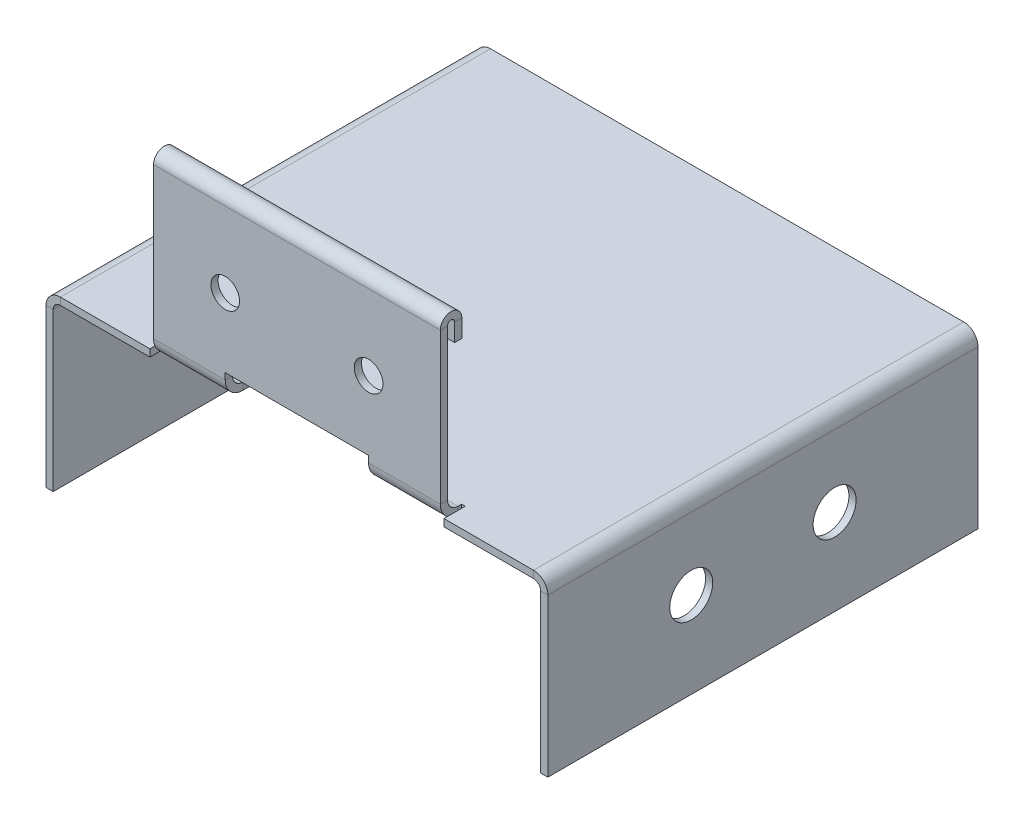
from build123d import *

# Parameters (mm, degrees)
SKETCH1_W                     = 35
SKETCH1_H                     = 30
BASE_FLANGE1_DEPTH            = 0.5
EDGE_FLANGE1_STRIP_W          = 3
EDGE_FLANGE1_STRIP_H          = 0.5
EDGE_FLANGE1_STRIP_CUT_DEPTH  = 30
EDGE_FLANGE1_DEPTH            = 30
EDGE_FLANGE2_STRIP_W          = 3
EDGE_FLANGE2_STRIP_H          = 0.5
EDGE_FLANGE2_STRIP_CUT_DEPTH  = 30
EDGE_FLANGE2_DEPTH            = 30
SKETCH12_R                    = 1.5
CUT_EXTRUDE1_DEPTH            = 40
EDGE_FLANGE4_STRIP_W          = 3.4732
EDGE_FLANGE4_STRIP_H          = 0.5
EDGE_FLANGE4_STRIP_CUT_DEPTH  = 20
EDGE_FLANGE4_RELIEF_W         = 3.7232
EDGE_FLANGE4_RELIEF_H         = 0.25
EDGE_FLANGE4_RELIEF_CUT_DEPTH = 0.5
EDGE_FLANGE4_DEPTH            = 20
SKETCH25_R                    = 1
CUT_EXTRUDE2_DEPTH            = 0.5
HEM1_START                    = 7.5
HEM1_DEPTH                    = 20
HEM1_2_DEPTH                  = 20
UNFOLD1_OUTLINE_W             = 20
UNFOLD1_OUTLINE_H             = 1.5
UNFOLD1_DEPTH                 = 13
UNFOLD1_START                 = -0.5
UNFOLD1_2_OUTLINE_W           = 20
UNFOLD1_2_OUTLINE_H           = 11.076547656
UNFOLD1_2_OUTLINE_R           = 1
UNFOLD1_2_DEPTH               = 0.5
UNFOLD1_START_2               = 7.5
UNFOLD1_3_DEPTH               = 20
SKETCH30_W                    = 10
SKETCH30_H                    = 4
CUT_EXTRUDE3_DEPTH            = 0.5
FOLD1_START                   = 7.5
FOLD1_DEPTH                   = 20
FOLD1_START_2                 = 13.5000001
FOLD1_2_DEPTH                 = 7.9999998
FOLD1_3_DEPTH                 = 3.9999999
FOLD1_START_3                 = 23.5000001
FOLD1_4_DEPTH                 = 3.9999999
FOLD1_5_DEPTH                 = 5
FOLD1_START_4                 = 22.5
FOLD1_6_DEPTH                 = 5
FOLD1_START_5                 = -0.5
FOLD1_7_DEPTH                 = 0.5
FOLD1_START_6                 = 11.4999999
FOLD1_8_DEPTH                 = 12.0000002


with BuildPart() as part:
    # Base-Flange1: sheet metal written as solids
    # Sketch1 → Base-Flange1 (new body)
    with BuildSketch(Plane(origin=(0, 0, 0), x_dir=(1, 0, 0), z_dir=(0, 1, 0))):
        with Locations((17.5, 15)):
            Rectangle(SKETCH1_W, SKETCH1_H)
    extrude(amount=-BASE_FLANGE1_DEPTH)

    # Edge-Flange1: sheet metal written as solids
    # Edge-Flange1 strip (on a plane across the edge) → Edge-Flange1 strip cut (cut)
    with BuildSketch(Plane(origin=(35, -0.5, -30), x_dir=(-1, 0, 0), z_dir=(0, 0, 1))):
        with Locations((-0.5, -0.25)):
            Rectangle(EDGE_FLANGE1_STRIP_W, EDGE_FLANGE1_STRIP_H)
    extrude(amount=EDGE_FLANGE1_STRIP_CUT_DEPTH, mode=Mode.SUBTRACT)

    # Edge-Flange1 section (on a plane across the edge) → Edge-Flange1 (add)
    with BuildSketch(Plane(origin=(35, -0.5, -30), x_dir=(-1, 0, 0), z_dir=(0, 0, 1))):
        with BuildLine():
            Line((0, 0.5), (0, 11.5))
            Line((0, 11.5), (0.5, 11.5))
            Line((0.5, 11.5), (0.5, 0.5))
            ThreePointArc((0.5, 0.5), (0.646446609, 0.146446609), (1, 0))
            Line((1, 0), (1, -0.5))
            ThreePointArc((1, -0.5), (0.292893219, -0.207106781), (0, 0.5))
        make_face()
    extrude(amount=EDGE_FLANGE1_DEPTH)

    # Edge-Flange2: sheet metal written as solids
    # Edge-Flange2 strip (on a plane across the edge) → Edge-Flange2 strip cut (cut)
    with BuildSketch(Plane(origin=(0, -0.5, 0), x_dir=(1, 0, 0), z_dir=(0, 0, -1))):
        with Locations((-0.5, -0.25)):
            Rectangle(EDGE_FLANGE2_STRIP_W, EDGE_FLANGE2_STRIP_H)
    extrude(amount=EDGE_FLANGE2_STRIP_CUT_DEPTH, mode=Mode.SUBTRACT)

    # Edge-Flange2 section (on a plane across the edge) → Edge-Flange2 (add)
    with BuildSketch(Plane(origin=(0, -0.5, 0), x_dir=(1, 0, 0), z_dir=(0, 0, -1))):
        with BuildLine():
            Line((0, 0.5), (0, 11.5))
            Line((0, 11.5), (0.5, 11.5))
            Line((0.5, 11.5), (0.5, 0.5))
            ThreePointArc((0.5, 0.5), (0.646446609, 0.146446609), (1, 0))
            Line((1, 0), (1, -0.5))
            ThreePointArc((1, -0.5), (0.292893219, -0.207106781), (0, 0.5))
        make_face()
    extrude(amount=EDGE_FLANGE2_DEPTH)

    # Sketch12 → Cut-Extrude1 (cut)
    with BuildSketch(Plane.ZY):
        with Locations(Location((-20, -6, 0), (0, 0, 270))):
            Circle(SKETCH12_R)
        with Locations(Location((-10, -6, 0), (0, 0, 270))):
            Circle(SKETCH12_R)
    extrude(amount=-CUT_EXTRUDE1_DEPTH, mode=Mode.SUBTRACT)

    # Edge-Flange4: sheet metal written as solids
    # Edge-Flange4 strip (on a plane across the edge) → Edge-Flange4 strip cut (cut)
    with BuildSketch(Plane(origin=(7.5, 0, 0), x_dir=(0, 0, -1), z_dir=(1, 0, 0))):
        with Locations((-0.5, -0.25)):
            Rectangle(EDGE_FLANGE4_STRIP_W, EDGE_FLANGE4_STRIP_H)
    extrude(amount=EDGE_FLANGE4_STRIP_CUT_DEPTH, mode=Mode.SUBTRACT)

    # Edge-Flange4 relief (on the sheet) → Edge-Flange4 relief cut (cut)
    with BuildSketch(Plane(origin=(7.5, 0, -1.2366), x_dir=(0, 0, -1), z_dir=(0, 1, 0))):
        with Locations((-1.6116, 0.125)):
            Rectangle(EDGE_FLANGE4_RELIEF_W, EDGE_FLANGE4_RELIEF_H)
        with Locations((-1.6116, -20.125)):
            Rectangle(EDGE_FLANGE4_RELIEF_W, EDGE_FLANGE4_RELIEF_H)
    extrude(amount=-EDGE_FLANGE4_RELIEF_CUT_DEPTH, mode=Mode.SUBTRACT)

    # Edge-Flange4 section (on a plane across the edge) → Edge-Flange4 (add)
    with BuildSketch(Plane(origin=(7.5, 0, 0), x_dir=(0, 0, -1), z_dir=(1, 0, 0))):
        with BuildLine():
            Line((0, 0.7366), (0, 12))
            Line((0, 12), (0.5, 12))
            Line((0.5, 12), (0.5, 0.7366))
            ThreePointArc((0.5, 0.7366), (0.715745145, 0.215745145), (1.2366, 0))
            Line((1.2366, 0), (1.2366, -0.5))
            ThreePointArc((1.2366, -0.5), (0.362191754, -0.137808246), (0, 0.7366))
        make_face()
    extrude(amount=EDGE_FLANGE4_DEPTH)

    # Sketch25 → Cut-Extrude2 (cut)
    with BuildSketch(Plane.XY):
        with Locations((12.5, 6)):
            Circle(SKETCH25_R)
        with Locations(Location((22.5, 6, 0), (0, 0, 180))):
            Circle(SKETCH25_R)
    extrude(amount=-CUT_EXTRUDE2_DEPTH, mode=Mode.SUBTRACT)

    # Hem1: read off the stored shape, not the designer's step
    # Hem1 outline → Hem1 (cut)
    with BuildSketch(Plane.YZ.offset(HEM1_START)):
        with BuildLine():
            ThreePointArc((11.25, 0), (11.683012702, -0.137627564), (11.957106781, -0.5))
            Line((11.957106781, -0.5), (12, -0.5))
            Line((12, -0.5), (12, 0))
            Line((12, 0), (11.25, 0))
        make_face()
    extrude(amount=HEM1_DEPTH, mode=Mode.SUBTRACT)

    # Hem1 2 outline → Hem1 2 (add)
    with BuildSketch(Plane.YZ.offset(HEM1_START)):
        with BuildLine():
            Line((10, -1), (10, -1.5))
            Line((10, -1.5), (11.25, -1.5))
            ThreePointArc((11.25, -1.5), (11.862372436, -1.183012702), (11.957106781, -0.5))
            Line((11.957106781, -0.5), (11.25, -0.5))
            ThreePointArc((11.25, -0.5), (11.5, -0.75), (11.25, -1))
            Line((11.25, -1), (10, -1))
        make_face()
    extrude(amount=HEM1_2_DEPTH)

    # Unfold1: read off the stored shape, not the designer's step
    # Unfold1 outline → Unfold1 (cut)
    with BuildSketch(Plane(origin=(0, 0, 0), x_dir=(1, 0, 0), z_dir=(0, 1, 0))):
        with Locations((17.5, 0.75)):
            Rectangle(UNFOLD1_OUTLINE_W, UNFOLD1_OUTLINE_H)
    extrude(amount=UNFOLD1_DEPTH, mode=Mode.SUBTRACT)

    # Unfold1 2 outline → Unfold1 2 (add)
    with BuildSketch(Plane(origin=(0, 0, 0), x_dir=(1, 0, 0), z_dir=(0, 1, 0)).offset(UNFOLD1_START)):
        with Locations((17.5, -4.038273828)):
            Rectangle(UNFOLD1_2_OUTLINE_W, UNFOLD1_2_OUTLINE_H)
        with Locations((12.5, -5.576547656)):
            Circle(UNFOLD1_2_OUTLINE_R, mode=Mode.SUBTRACT)
        with Locations((22.5, -5.576547656)):
            Circle(UNFOLD1_2_OUTLINE_R, mode=Mode.SUBTRACT)
    extrude(amount=UNFOLD1_2_DEPTH)

    # Unfold1 3 outline → Unfold1 3 (add)
    with BuildSketch(Plane.YZ.offset(UNFOLD1_START_2)):
        with BuildLine():
            Line((-0.5, 10.826547656), (-0.5, 9.576547656))
            Line((-0.5, 9.576547656), (0, 9.576547656))
            Line((0, 9.576547656), (0, 10.826547656))
            ThreePointArc((0, 10.826547656), (0.25, 11.076547656), (0.5, 10.826547656))
            Line((0.5, 10.826547656), (0.5, 9.576547656))
            Line((0.5, 9.576547656), (1, 9.576547656))
            Line((1, 9.576547656), (1, 10.826547656))
            ThreePointArc((1, 10.826547656), (0.25, 11.576547656), (-0.5, 10.826547656))
        make_face()
    extrude(amount=UNFOLD1_3_DEPTH)

    # Sketch30 → Cut-Extrude3 (cut)
    with BuildSketch(Plane(origin=(0, 0, 0), x_dir=(1, 0, 0), z_dir=(0, 1, 0))):
        with Locations((17.5, 1.2366)):
            Rectangle(SKETCH30_W, SKETCH30_H)
    extrude(amount=-CUT_EXTRUDE3_DEPTH, mode=Mode.SUBTRACT)

    # Fold1: read off the stored shape, not the designer's step
    # Fold1 outline → Fold1 (cut)
    with BuildSketch(Plane.YZ.offset(FOLD1_START)):
        with BuildLine():
            ThreePointArc((-0.5, -1.2366), (-0.367949483, -0.68058741), (0, -0.243322596))
            Line((0, -0.243322596), (0, 10.826547656))
            ThreePointArc((0, 10.826547656), (0.25, 11.076547656), (0.5, 10.826547656))
            Line((0.5, 10.826547656), (0.5, 9.576547656))
            Line((0.5, 9.576547656), (1, 9.576547656))
            Line((1, 9.576547656), (1, 10.826547656))
            ThreePointArc((1, 10.826547656), (0.25, 11.576547656), (-0.5, 10.826547656))
            Line((-0.5, 10.826547656), (-0.5, -1.2366))
        make_face()
    extrude(amount=FOLD1_DEPTH, mode=Mode.SUBTRACT)

    # Fold1 3 outline → Fold1 3 (add)
    with BuildSketch(Plane.YZ.offset(FOLD1_START)):
        with BuildLine():
            ThreePointArc((0.7366, 0), (0.348725843, -0.062405298), (0, -0.243322596))
            Line((0, -0.243322596), (0, -1.2366))
            ThreePointArc((0, -1.2366), (0.215745145, -0.715745145), (0.7366, -0.5))
            Line((0.7366, -0.5), (11.25, -0.5))
            ThreePointArc((11.25, -0.5), (11.5, -0.75), (11.25, -1))
            Line((11.25, -1), (10, -1))
            Line((10, -1), (10, -1.5))
            Line((10, -1.5), (11.25, -1.5))
            ThreePointArc((11.25, -1.5), (12, -0.75), (11.25, 0))
            Line((11.25, 0), (0.7366, 0))
        make_face()
    extrude(amount=FOLD1_3_DEPTH)

    # Fold1 4 outline → Fold1 4 (add)
    with BuildSketch(Plane.YZ.offset(FOLD1_START_3)):
        with BuildLine():
            ThreePointArc((0.7366, 0), (0.348725843, -0.062405298), (0, -0.243322596))
            Line((0, -0.243322596), (0, -1.2366))
            ThreePointArc((0, -1.2366), (0.215745145, -0.715745145), (0.7366, -0.5))
            Line((0.7366, -0.5), (11.25, -0.5))
            ThreePointArc((11.25, -0.5), (11.5, -0.75), (11.25, -1))
            Line((11.25, -1), (10, -1))
            Line((10, -1), (10, -1.5))
            Line((10, -1.5), (11.25, -1.5))
            ThreePointArc((11.25, -1.5), (12, -0.75), (11.25, 0))
            Line((11.25, 0), (0.7366, 0))
        make_face()
    extrude(amount=FOLD1_4_DEPTH)

    # Fold1 5 outline → Fold1 5 (add)
    with BuildSketch(Plane.YZ.offset(FOLD1_START)):
        with BuildLine():
            Line((1.186852344, 0), (0.7366, 0))
            ThreePointArc((0.7366, 0), (0.348725843, -0.062405298), (0, -0.243322596))
            Line((0, -0.243322596), (0, -1.2366))
            ThreePointArc((0, -1.2366), (0.215745145, -0.715745145), (0.7366, -0.5))
            Line((0.7366, -0.5), (1.186852344, -0.5))
            Line((1.186852344, -0.5), (1.186852344, 0))
        make_face()
    extrude(amount=FOLD1_5_DEPTH)

    # Fold1 6 outline → Fold1 6 (add)
    with BuildSketch(Plane.YZ.offset(FOLD1_START_4)):
        with BuildLine():
            Line((1.186852344, 0), (0.7366, 0))
            ThreePointArc((0.7366, 0), (0.348725843, -0.062405298), (0, -0.243322596))
            Line((0, -0.243322596), (0, -1.2366))
            ThreePointArc((0, -1.2366), (0.215745145, -0.715745145), (0.7366, -0.5))
            Line((0.7366, -0.5), (1.186852344, -0.5))
            Line((1.186852344, -0.5), (1.186852344, 0))
        make_face()
    extrude(amount=FOLD1_6_DEPTH)



with BuildPart() as body_2:
    # Fold1 2 outline → Fold1 2 (new body)
    with BuildSketch(Plane.YZ.offset(FOLD1_START_2)):
        with BuildLine():
            Line((11.25, 0), (1.186852344, 0))
            Line((1.186852344, 0), (1.186852344, -0.5))
            Line((1.186852344, -0.5), (11.25, -0.5))
            ThreePointArc((11.25, -0.5), (11.5, -0.75), (11.25, -1))
            Line((11.25, -1), (10, -1))
            Line((10, -1), (10, -1.5))
            Line((10, -1.5), (11.25, -1.5))
            ThreePointArc((11.25, -1.5), (12, -0.75), (11.25, 0))
        make_face()
    extrude(amount=FOLD1_2_DEPTH)


with BuildPart() as part_1:
    add(part.part)

    add(body_2.part)  # Fold1 7 merges body 2
    # Fold1 7 outline → Fold1 7 (add)
    with BuildSketch(Plane.XY.offset(FOLD1_START_5)):
        with BuildLine():
            Line((13.5000001, 1.186852344), (13.5, 6))
            ThreePointArc((13.5, 6), (12.5, 5), (11.5, 6))
            Line((11.5, 6), (11.4999999, 1.186852344))
            Line((11.4999999, 1.186852344), (13.5000001, 1.186852344))
        make_face()
        with BuildLine():
            ThreePointArc((11.5, 6), (12.5, 7), (13.5, 6))
            Line((13.5, 6), (13.5000001, 10))
            Line((13.5000001, 10), (11.4999999, 10))
            Line((11.4999999, 10), (11.5, 6))
        make_face()
        with BuildLine():
            Line((21.5, 6), (21.4999999, 1.186852344))
            Line((21.4999999, 1.186852344), (23.5000001, 1.186852344))
            Line((23.5000001, 1.186852344), (23.5, 6))
            ThreePointArc((23.5, 6), (22.5, 5), (21.5, 6))
        make_face()
        with BuildLine():
            Line((23.5000001, 10), (21.4999999, 10))
            Line((21.4999999, 10), (21.5, 6))
            ThreePointArc((21.5, 6), (22.5, 7), (23.5, 6))
            Line((23.5, 6), (23.5000001, 10))
        make_face()
    extrude(amount=FOLD1_7_DEPTH)

    # Fold1 8 outline → Fold1 8 (add)
    with BuildSketch(Plane.YZ.offset(FOLD1_START_6)):
        with BuildLine():
            Line((11.25, 0), (10, 0))
            Line((10, 0), (10, -0.5))
            Line((10, -0.5), (11.25, -0.5))
            ThreePointArc((11.25, -0.5), (11.5, -0.75), (11.25, -1))
            Line((11.25, -1), (10, -1))
            Line((10, -1), (10, -1.5))
            Line((10, -1.5), (11.25, -1.5))
            ThreePointArc((11.25, -1.5), (12, -0.75), (11.25, 0))
        make_face()
    extrude(amount=FOLD1_8_DEPTH)


solid = part_1.part
